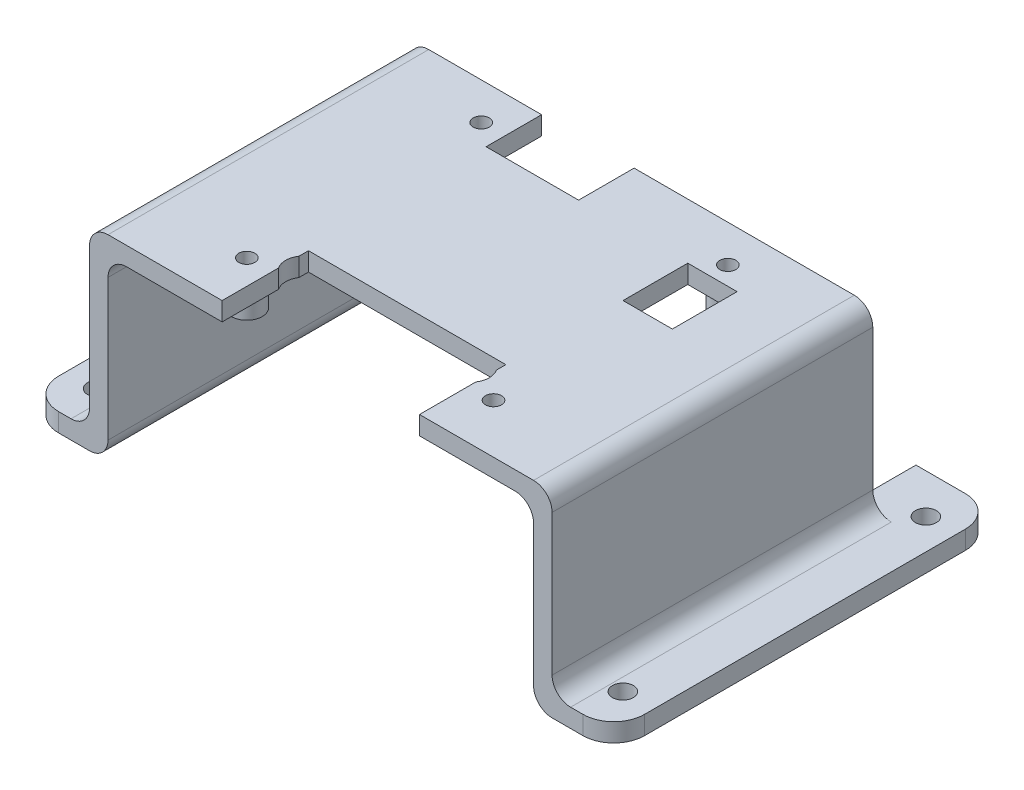
from build123d import *

# Parameters (mm, degrees)
SKETCH1_W           = 95
SKETCH1_H           = 62
SKETCH1_R           = 1.7
BOSS_EXTRUDE1_DEPTH = 3
SKETCH2_W           = 75
SKETCH2_H           = 52
BOSS_EXTRUDE2_DEPTH = 28.85
SKETCH3_W           = 69
SKETCH3_H           = 25.85
CUT_EXTRUDE1_DEPTH  = 118.827935991
SKETCH4_W           = 69
SKETCH4_H           = 3
CUT_EXTRUDE2_DEPTH  = 118.827935991
SKETCH5_R           = 1.3
SKETCH5_W           = 32
SKETCH5_H           = 14
CUT_EXTRUDE3_DEPTH  = 118.827935991
SKETCH7_R           = 3
CUT_EXTRUDE5_DEPTH  = 118.827935991
SKETCH6_W           = 15
SKETCH6_H           = 9
SKETCH6_W_2         = 8
SKETCH6_H_2         = 10.5
CUT_EXTRUDE4_DEPTH  = 118.827935991
FILLET1_R           = 3
SKETCH8_R           = 2.5
SKETCH8_R_2         = 1.3
BOSS_EXTRUDE4_DEPTH = 4
FILLET2_R           = 5


with BuildPart() as part:
    # Sketch1 → Boss-Extrude1 (new body)
    with BuildSketch(Plane(origin=(0, 0, 0), x_dir=(1, 0, 0), z_dir=(0, 1, 0))):
        with Locations((47.5, 31)):
            Rectangle(SKETCH1_W, SKETCH1_H)
        with Locations((90.04349796, 55.565)):
            Circle(SKETCH1_R, mode=Mode.SUBTRACT)
        with Locations((90.04349796, 6.435)):
            Circle(SKETCH1_R, mode=Mode.SUBTRACT)
        with Locations((4.95650204, 55.565)):
            Circle(SKETCH1_R, mode=Mode.SUBTRACT)
        with Locations((4.95650204, 6.435)):
            Circle(SKETCH1_R, mode=Mode.SUBTRACT)
    extrude(amount=BOSS_EXTRUDE1_DEPTH)

    # Sketch2 → Boss-Extrude2 (add)
    with BuildSketch(Plane(origin=(0, 3, 0), x_dir=(1, 0, 0), z_dir=(0, 1, 0))):
        with Locations((47.5, 26)):
            Rectangle(SKETCH2_W, SKETCH2_H)
    extrude(amount=BOSS_EXTRUDE2_DEPTH)

    # Sketch3 → Cut-Extrude1 (cut, through all)
    with BuildSketch(Plane.XY):
        with Locations((47.5, 15.925)):
            Rectangle(SKETCH3_W, SKETCH3_H)
    extrude(amount=-CUT_EXTRUDE1_DEPTH, mode=Mode.SUBTRACT)

    # Sketch4 → Cut-Extrude2 (cut, through all)
    with BuildSketch(Plane.XY):
        with Locations((47.5, 1.5)):
            Rectangle(SKETCH4_W, SKETCH4_H)
    extrude(amount=-CUT_EXTRUDE2_DEPTH, mode=Mode.SUBTRACT)

    # Sketch5 → Cut-Extrude3 (cut, through all)
    with BuildSketch(Plane(origin=(0, 31.85, 0), x_dir=(1, 0, 0), z_dir=(0, 1, 0))):
        with Locations((27.5, 46)):
            Circle(SKETCH5_R)
        with Locations((27.5, 8)):
            Circle(SKETCH5_R)
        with Locations((67.5, 8)):
            Circle(SKETCH5_R)
        with Locations((67.5, 46)):
            Circle(SKETCH5_R)
        with Locations((47.5, 7)):
            Rectangle(SKETCH5_W, SKETCH5_H)
    extrude(amount=-CUT_EXTRUDE3_DEPTH, mode=Mode.SUBTRACT)

    # Sketch7 → Cut-Extrude5 (cut, through all)
    with BuildSketch(Plane(origin=(0, 31.85, 0), x_dir=(1, 0, 0), z_dir=(0, 1, 0))):
        with Locations((34, 10.8)):
            Circle(SKETCH7_R)
        with Locations((61, 10.8)):
            Circle(SKETCH7_R)
    extrude(amount=-CUT_EXTRUDE5_DEPTH, mode=Mode.SUBTRACT)

    # Sketch6 → Cut-Extrude4 (cut, through all)
    with BuildSketch(Plane(origin=(0, 31.85, 0), x_dir=(1, 0, 0), z_dir=(0, 1, 0))):
        with Locations((38.8, 47.5)):
            Rectangle(SKETCH6_W, SKETCH6_H)
        with Locations((68, 37.75)):
            Rectangle(SKETCH6_W_2, SKETCH6_H_2)
    extrude(amount=-CUT_EXTRUDE4_DEPTH, mode=Mode.SUBTRACT)

    # Fillet1
    fillet1_edges = [part.edges().sort_by_distance(p)[0] for p in [
        (13, 0, -31),
        (82, 0, -31),
        (10, 3, -26),
        (85, 3, -26),
        (10, 31.85, -26),
        (85, 31.85, -26),
        (13, 28.85, -26),
        (82, 28.85, -26),
    ]]
    fillet(fillet1_edges, radius=FILLET1_R)

    # Sketch8 → Boss-Extrude4 (add)
    # profile 1 of 4: a face of its own
    with BuildSketch(Plane.XZ.offset(-28.85)):
        with Locations((27.5, -8)):
            Circle(SKETCH8_R)
        with Locations((27.5, -8)):
            Circle(SKETCH8_R_2, mode=Mode.SUBTRACT)
    # profile 2 of 4: a face of its own
    with BuildSketch(Plane.XZ.offset(-28.85)):
        with Locations((67.5, -8)):
            Circle(SKETCH8_R)
        with Locations((67.5, -8)):
            Circle(SKETCH8_R_2, mode=Mode.SUBTRACT)
    # profile 3 of 4: a face of its own
    with BuildSketch(Plane.XZ.offset(-28.85)):
        with Locations((27.5, -46)):
            Circle(SKETCH8_R)
        with Locations((27.5, -46)):
            Circle(SKETCH8_R_2, mode=Mode.SUBTRACT)
    # profile 4 of 4: a face of its own
    with BuildSketch(Plane.XZ.offset(-28.85)):
        with Locations((67.5, -46)):
            Circle(SKETCH8_R)
        with Locations((67.5, -46)):
            Circle(SKETCH8_R_2, mode=Mode.SUBTRACT)
    extrude(amount=BOSS_EXTRUDE4_DEPTH)

    # Fillet2
    fillet2_edges = [part.edges().sort_by_distance(p)[0] for p in [
        (95, 1.5, -62),
        (95, 1.5, 0),
        (0, 1.5, 0),
        (0, 1.5, -62),
    ]]
    fillet(fillet2_edges, radius=FILLET2_R)


solid = part.part
